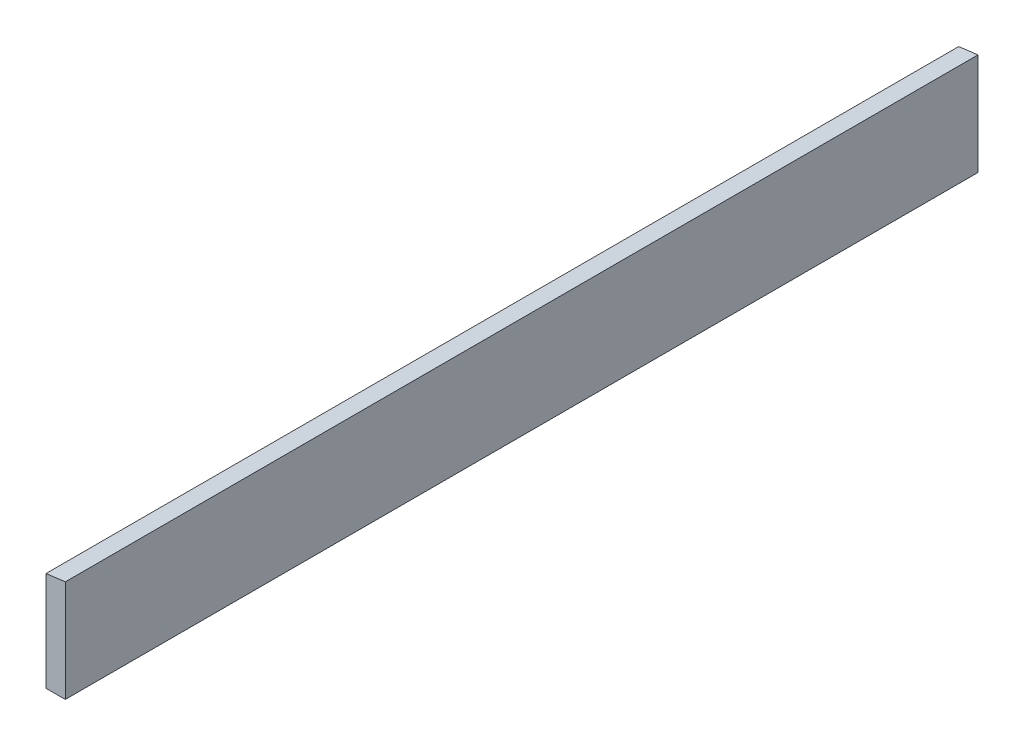
from build123d import *

# Parameters (mm, degrees)
BOSS_EXTRUDE1_DEPTH = 901.7


with BuildPart() as part:
    # Sketch1 → Boss-Extrude1 (new body)
    with BuildSketch(Plane.XY):
        Polygon((207.386295427, 125.448242148), (207.386295427, 27.19467147), (226.436295427, 27.19467147), (226.436295427, 127.831059213), align=None)
    extrude(amount=BOSS_EXTRUDE1_DEPTH)


solid = part.part
